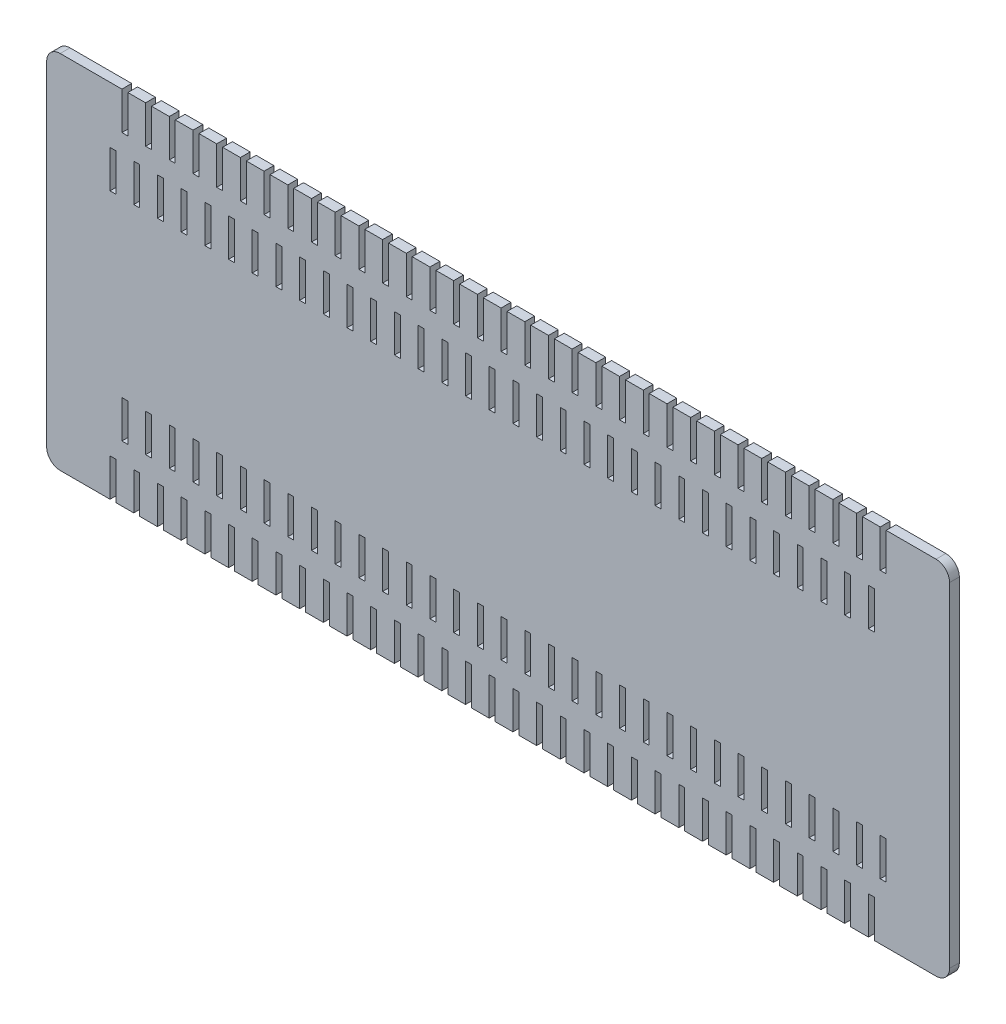
from build123d import *

# Parameters (mm, degrees)
BOSS_EXTRUDE1_DEPTH          = 1.651
SKETCH4_W                    = 1
SKETCH4_H                    = 6.35
CUT_EXTRUDE1_DEPTH           = 83.08651656
LPATTERN1_COUNT              = 33
LPATTERN1_PITCH              = 4
CIRPATTERN1_COUNT            = 2
CIRPATTERN1_ANGLE            = 180
CIRPATTERN1_COPY_1_SKETCH_W  = 1
CIRPATTERN1_COPY_1_SKETCH_H  = 6.35
CIRPATTERN1_COPY_1_DEPTH     = 83.08651656
CIRPATTERN1_COPY_2_SKETCH_W  = 1
CIRPATTERN1_COPY_2_SKETCH_H  = 6.35
CIRPATTERN1_COPY_2_DEPTH     = 83.08651656
CIRPATTERN1_COPY_3_SKETCH_W  = 1
CIRPATTERN1_COPY_3_SKETCH_H  = 6.35
CIRPATTERN1_COPY_3_DEPTH     = 83.08651656
CIRPATTERN1_COPY_4_SKETCH_W  = 1
CIRPATTERN1_COPY_4_SKETCH_H  = 6.35
CIRPATTERN1_COPY_4_DEPTH     = 83.08651656
CIRPATTERN1_COPY_5_SKETCH_W  = 1
CIRPATTERN1_COPY_5_SKETCH_H  = 6.35
CIRPATTERN1_COPY_5_DEPTH     = 83.08651656
CIRPATTERN1_COPY_6_SKETCH_W  = 1
CIRPATTERN1_COPY_6_SKETCH_H  = 6.35
CIRPATTERN1_COPY_6_DEPTH     = 83.08651656
CIRPATTERN1_COPY_7_SKETCH_W  = 1
CIRPATTERN1_COPY_7_SKETCH_H  = 6.35
CIRPATTERN1_COPY_7_DEPTH     = 83.08651656
CIRPATTERN1_COPY_8_SKETCH_W  = 1
CIRPATTERN1_COPY_8_SKETCH_H  = 6.35
CIRPATTERN1_COPY_8_DEPTH     = 83.08651656
CIRPATTERN1_COPY_9_SKETCH_W  = 1
CIRPATTERN1_COPY_9_SKETCH_H  = 6.35
CIRPATTERN1_COPY_9_DEPTH     = 83.08651656
CIRPATTERN1_COPY_10_SKETCH_W = 1
CIRPATTERN1_COPY_10_SKETCH_H = 6.35
CIRPATTERN1_COPY_10_DEPTH    = 83.08651656
CIRPATTERN1_COPY_11_SKETCH_W = 1
CIRPATTERN1_COPY_11_SKETCH_H = 6.35
CIRPATTERN1_COPY_11_DEPTH    = 83.08651656
CIRPATTERN1_COPY_12_SKETCH_W = 1
CIRPATTERN1_COPY_12_SKETCH_H = 6.35
CIRPATTERN1_COPY_12_DEPTH    = 83.08651656
CIRPATTERN1_COPY_13_SKETCH_W = 1
CIRPATTERN1_COPY_13_SKETCH_H = 6.35
CIRPATTERN1_COPY_13_DEPTH    = 83.08651656
CIRPATTERN1_COPY_14_SKETCH_W = 1
CIRPATTERN1_COPY_14_SKETCH_H = 6.35
CIRPATTERN1_COPY_14_DEPTH    = 83.08651656
CIRPATTERN1_COPY_15_SKETCH_W = 1
CIRPATTERN1_COPY_15_SKETCH_H = 6.35
CIRPATTERN1_COPY_15_DEPTH    = 83.08651656
CIRPATTERN1_COPY_16_SKETCH_W = 1
CIRPATTERN1_COPY_16_SKETCH_H = 6.35
CIRPATTERN1_COPY_16_DEPTH    = 83.08651656
CIRPATTERN1_COPY_17_SKETCH_W = 1
CIRPATTERN1_COPY_17_SKETCH_H = 6.35
CIRPATTERN1_COPY_17_DEPTH    = 83.08651656
CIRPATTERN1_COPY_18_SKETCH_W = 1
CIRPATTERN1_COPY_18_SKETCH_H = 6.35
CIRPATTERN1_COPY_18_DEPTH    = 83.08651656
CIRPATTERN1_COPY_19_SKETCH_W = 1
CIRPATTERN1_COPY_19_SKETCH_H = 6.35
CIRPATTERN1_COPY_19_DEPTH    = 83.08651656
CIRPATTERN1_COPY_20_SKETCH_W = 1
CIRPATTERN1_COPY_20_SKETCH_H = 6.35
CIRPATTERN1_COPY_20_DEPTH    = 83.08651656
CIRPATTERN1_COPY_21_SKETCH_W = 1
CIRPATTERN1_COPY_21_SKETCH_H = 6.35
CIRPATTERN1_COPY_21_DEPTH    = 83.08651656
CIRPATTERN1_COPY_22_SKETCH_W = 1
CIRPATTERN1_COPY_22_SKETCH_H = 6.35
CIRPATTERN1_COPY_22_DEPTH    = 83.08651656
CIRPATTERN1_COPY_23_SKETCH_W = 1
CIRPATTERN1_COPY_23_SKETCH_H = 6.35
CIRPATTERN1_COPY_23_DEPTH    = 83.08651656
CIRPATTERN1_COPY_24_SKETCH_W = 1
CIRPATTERN1_COPY_24_SKETCH_H = 6.35
CIRPATTERN1_COPY_24_DEPTH    = 83.08651656
CIRPATTERN1_COPY_25_SKETCH_W = 1
CIRPATTERN1_COPY_25_SKETCH_H = 6.35
CIRPATTERN1_COPY_25_DEPTH    = 83.08651656
CIRPATTERN1_COPY_26_SKETCH_W = 1
CIRPATTERN1_COPY_26_SKETCH_H = 6.35
CIRPATTERN1_COPY_26_DEPTH    = 83.08651656
CIRPATTERN1_COPY_27_SKETCH_W = 1
CIRPATTERN1_COPY_27_SKETCH_H = 6.35
CIRPATTERN1_COPY_27_DEPTH    = 83.08651656
CIRPATTERN1_COPY_28_SKETCH_W = 1
CIRPATTERN1_COPY_28_SKETCH_H = 6.35
CIRPATTERN1_COPY_28_DEPTH    = 83.08651656
CIRPATTERN1_COPY_29_SKETCH_W = 1
CIRPATTERN1_COPY_29_SKETCH_H = 6.35
CIRPATTERN1_COPY_29_DEPTH    = 83.08651656
CIRPATTERN1_COPY_30_SKETCH_W = 1
CIRPATTERN1_COPY_30_SKETCH_H = 6.35
CIRPATTERN1_COPY_30_DEPTH    = 83.08651656
CIRPATTERN1_COPY_31_SKETCH_W = 1
CIRPATTERN1_COPY_31_SKETCH_H = 6.35
CIRPATTERN1_COPY_31_DEPTH    = 83.08651656
CIRPATTERN1_COPY_32_SKETCH_W = 1
CIRPATTERN1_COPY_32_SKETCH_H = 6.35
CIRPATTERN1_COPY_32_DEPTH    = 83.08651656


with BuildPart() as part:
    # Sketch1 → Boss-Extrude1 (new body)
    with BuildSketch(Plane.XY):
        with BuildLine():
            Line((76.2, -28.194), (76.2, 28.194))
            ThreePointArc((76.2, 28.194), (75.530446102, 29.810446102), (73.914, 30.48))
            Line((73.914, 30.48), (-73.914, 30.48))
            ThreePointArc((-73.914, 30.48), (-75.530446102, 29.810446102), (-76.2, 28.194))
            Line((-76.2, 28.194), (-76.2, -28.194))
            ThreePointArc((-76.2, -28.194), (-75.530446102, -29.810446102), (-73.914, -30.48))
            Line((-73.914, -30.48), (73.914, -30.48))
            ThreePointArc((73.914, -30.48), (75.530446102, -29.810446102), (76.2, -28.194))
        make_face()
    extrude(amount=BOSS_EXTRUDE1_DEPTH)

    # Sketch4 → Cut-Extrude1 (cut, through all)
    with BuildSketch(Plane.XY.offset(1.651)):
        with Locations((-63.000000018, 27.305)):
            Rectangle(SKETCH4_W, SKETCH4_H)
        with Locations((-63.000000018, -17.78)):
            Rectangle(SKETCH4_W, SKETCH4_H)
    cut_extrude1 = extrude(amount=-CUT_EXTRUDE1_DEPTH, mode=Mode.SUBTRACT)

    # LPattern1: Cut-Extrude1 ×33
    with Locations(*[(i * LPATTERN1_PITCH, 0, 0) for i in range(1, LPATTERN1_COUNT)]):
        add(cut_extrude1, mode=Mode.SUBTRACT)

    # CirPattern1: Cut-Extrude1 ×2 about axis
    cirpattern1_axis = Axis((0, 0, 0), (0, 0, 1))
    for i in range(1, CIRPATTERN1_COUNT):
        add(cut_extrude1.rotate(cirpattern1_axis, i * CIRPATTERN1_ANGLE / (CIRPATTERN1_COUNT - 1)), mode=Mode.SUBTRACT)

    # CirPattern1 copy 1 sketch → CirPattern1 copy 1 (cut, through all)
    with BuildSketch(Plane(origin=(-4, 0, 1.651), x_dir=(-1, 0, 0), z_dir=(0, 0, 1))):
        with Locations((-63.000000018, 27.305)):
            Rectangle(CIRPATTERN1_COPY_1_SKETCH_W, CIRPATTERN1_COPY_1_SKETCH_H)
        with Locations((-63.000000018, -17.78)):
            Rectangle(CIRPATTERN1_COPY_1_SKETCH_W, CIRPATTERN1_COPY_1_SKETCH_H)
    extrude(amount=-CIRPATTERN1_COPY_1_DEPTH, mode=Mode.SUBTRACT)

    # CirPattern1 copy 2 sketch → CirPattern1 copy 2 (cut, through all)
    with BuildSketch(Plane(origin=(-8, 0, 1.651), x_dir=(-1, 0, 0), z_dir=(0, 0, 1))):
        with Locations((-63.000000018, 27.305)):
            Rectangle(CIRPATTERN1_COPY_2_SKETCH_W, CIRPATTERN1_COPY_2_SKETCH_H)
        with Locations((-63.000000018, -17.78)):
            Rectangle(CIRPATTERN1_COPY_2_SKETCH_W, CIRPATTERN1_COPY_2_SKETCH_H)
    extrude(amount=-CIRPATTERN1_COPY_2_DEPTH, mode=Mode.SUBTRACT)

    # CirPattern1 copy 3 sketch → CirPattern1 copy 3 (cut, through all)
    with BuildSketch(Plane(origin=(-12, 0, 1.651), x_dir=(-1, 0, 0), z_dir=(0, 0, 1))):
        with Locations((-63.000000018, 27.305)):
            Rectangle(CIRPATTERN1_COPY_3_SKETCH_W, CIRPATTERN1_COPY_3_SKETCH_H)
        with Locations((-63.000000018, -17.78)):
            Rectangle(CIRPATTERN1_COPY_3_SKETCH_W, CIRPATTERN1_COPY_3_SKETCH_H)
    extrude(amount=-CIRPATTERN1_COPY_3_DEPTH, mode=Mode.SUBTRACT)

    # CirPattern1 copy 4 sketch → CirPattern1 copy 4 (cut, through all)
    with BuildSketch(Plane(origin=(-16, 0, 1.651), x_dir=(-1, 0, 0), z_dir=(0, 0, 1))):
        with Locations((-63.000000018, 27.305)):
            Rectangle(CIRPATTERN1_COPY_4_SKETCH_W, CIRPATTERN1_COPY_4_SKETCH_H)
        with Locations((-63.000000018, -17.78)):
            Rectangle(CIRPATTERN1_COPY_4_SKETCH_W, CIRPATTERN1_COPY_4_SKETCH_H)
    extrude(amount=-CIRPATTERN1_COPY_4_DEPTH, mode=Mode.SUBTRACT)

    # CirPattern1 copy 5 sketch → CirPattern1 copy 5 (cut, through all)
    with BuildSketch(Plane(origin=(-20, 0, 1.651), x_dir=(-1, 0, 0), z_dir=(0, 0, 1))):
        with Locations((-63.000000018, 27.305)):
            Rectangle(CIRPATTERN1_COPY_5_SKETCH_W, CIRPATTERN1_COPY_5_SKETCH_H)
        with Locations((-63.000000018, -17.78)):
            Rectangle(CIRPATTERN1_COPY_5_SKETCH_W, CIRPATTERN1_COPY_5_SKETCH_H)
    extrude(amount=-CIRPATTERN1_COPY_5_DEPTH, mode=Mode.SUBTRACT)

    # CirPattern1 copy 6 sketch → CirPattern1 copy 6 (cut, through all)
    with BuildSketch(Plane(origin=(-24, 0, 1.651), x_dir=(-1, 0, 0), z_dir=(0, 0, 1))):
        with Locations((-63.000000018, 27.305)):
            Rectangle(CIRPATTERN1_COPY_6_SKETCH_W, CIRPATTERN1_COPY_6_SKETCH_H)
        with Locations((-63.000000018, -17.78)):
            Rectangle(CIRPATTERN1_COPY_6_SKETCH_W, CIRPATTERN1_COPY_6_SKETCH_H)
    extrude(amount=-CIRPATTERN1_COPY_6_DEPTH, mode=Mode.SUBTRACT)

    # CirPattern1 copy 7 sketch → CirPattern1 copy 7 (cut, through all)
    with BuildSketch(Plane(origin=(-28, 0, 1.651), x_dir=(-1, 0, 0), z_dir=(0, 0, 1))):
        with Locations((-63.000000018, 27.305)):
            Rectangle(CIRPATTERN1_COPY_7_SKETCH_W, CIRPATTERN1_COPY_7_SKETCH_H)
        with Locations((-63.000000018, -17.78)):
            Rectangle(CIRPATTERN1_COPY_7_SKETCH_W, CIRPATTERN1_COPY_7_SKETCH_H)
    extrude(amount=-CIRPATTERN1_COPY_7_DEPTH, mode=Mode.SUBTRACT)

    # CirPattern1 copy 8 sketch → CirPattern1 copy 8 (cut, through all)
    with BuildSketch(Plane(origin=(-32, 0, 1.651), x_dir=(-1, 0, 0), z_dir=(0, 0, 1))):
        with Locations((-63.000000018, 27.305)):
            Rectangle(CIRPATTERN1_COPY_8_SKETCH_W, CIRPATTERN1_COPY_8_SKETCH_H)
        with Locations((-63.000000018, -17.78)):
            Rectangle(CIRPATTERN1_COPY_8_SKETCH_W, CIRPATTERN1_COPY_8_SKETCH_H)
    extrude(amount=-CIRPATTERN1_COPY_8_DEPTH, mode=Mode.SUBTRACT)

    # CirPattern1 copy 9 sketch → CirPattern1 copy 9 (cut, through all)
    with BuildSketch(Plane(origin=(-36, 0, 1.651), x_dir=(-1, 0, 0), z_dir=(0, 0, 1))):
        with Locations((-63.000000018, 27.305)):
            Rectangle(CIRPATTERN1_COPY_9_SKETCH_W, CIRPATTERN1_COPY_9_SKETCH_H)
        with Locations((-63.000000018, -17.78)):
            Rectangle(CIRPATTERN1_COPY_9_SKETCH_W, CIRPATTERN1_COPY_9_SKETCH_H)
    extrude(amount=-CIRPATTERN1_COPY_9_DEPTH, mode=Mode.SUBTRACT)

    # CirPattern1 copy 10 sketch → CirPattern1 copy 10 (cut, through all)
    with BuildSketch(Plane(origin=(-40, 0, 1.651), x_dir=(-1, 0, 0), z_dir=(0, 0, 1))):
        with Locations((-63.000000018, 27.305)):
            Rectangle(CIRPATTERN1_COPY_10_SKETCH_W, CIRPATTERN1_COPY_10_SKETCH_H)
        with Locations((-63.000000018, -17.78)):
            Rectangle(CIRPATTERN1_COPY_10_SKETCH_W, CIRPATTERN1_COPY_10_SKETCH_H)
    extrude(amount=-CIRPATTERN1_COPY_10_DEPTH, mode=Mode.SUBTRACT)

    # CirPattern1 copy 11 sketch → CirPattern1 copy 11 (cut, through all)
    with BuildSketch(Plane(origin=(-44, 0, 1.651), x_dir=(-1, 0, 0), z_dir=(0, 0, 1))):
        with Locations((-63.000000018, 27.305)):
            Rectangle(CIRPATTERN1_COPY_11_SKETCH_W, CIRPATTERN1_COPY_11_SKETCH_H)
        with Locations((-63.000000018, -17.78)):
            Rectangle(CIRPATTERN1_COPY_11_SKETCH_W, CIRPATTERN1_COPY_11_SKETCH_H)
    extrude(amount=-CIRPATTERN1_COPY_11_DEPTH, mode=Mode.SUBTRACT)

    # CirPattern1 copy 12 sketch → CirPattern1 copy 12 (cut, through all)
    with BuildSketch(Plane(origin=(-48, 0, 1.651), x_dir=(-1, 0, 0), z_dir=(0, 0, 1))):
        with Locations((-63.000000018, 27.305)):
            Rectangle(CIRPATTERN1_COPY_12_SKETCH_W, CIRPATTERN1_COPY_12_SKETCH_H)
        with Locations((-63.000000018, -17.78)):
            Rectangle(CIRPATTERN1_COPY_12_SKETCH_W, CIRPATTERN1_COPY_12_SKETCH_H)
    extrude(amount=-CIRPATTERN1_COPY_12_DEPTH, mode=Mode.SUBTRACT)

    # CirPattern1 copy 13 sketch → CirPattern1 copy 13 (cut, through all)
    with BuildSketch(Plane(origin=(-52, 0, 1.651), x_dir=(-1, 0, 0), z_dir=(0, 0, 1))):
        with Locations((-63.000000018, 27.305)):
            Rectangle(CIRPATTERN1_COPY_13_SKETCH_W, CIRPATTERN1_COPY_13_SKETCH_H)
        with Locations((-63.000000018, -17.78)):
            Rectangle(CIRPATTERN1_COPY_13_SKETCH_W, CIRPATTERN1_COPY_13_SKETCH_H)
    extrude(amount=-CIRPATTERN1_COPY_13_DEPTH, mode=Mode.SUBTRACT)

    # CirPattern1 copy 14 sketch → CirPattern1 copy 14 (cut, through all)
    with BuildSketch(Plane(origin=(-56, 0, 1.651), x_dir=(-1, 0, 0), z_dir=(0, 0, 1))):
        with Locations((-63.000000018, 27.305)):
            Rectangle(CIRPATTERN1_COPY_14_SKETCH_W, CIRPATTERN1_COPY_14_SKETCH_H)
        with Locations((-63.000000018, -17.78)):
            Rectangle(CIRPATTERN1_COPY_14_SKETCH_W, CIRPATTERN1_COPY_14_SKETCH_H)
    extrude(amount=-CIRPATTERN1_COPY_14_DEPTH, mode=Mode.SUBTRACT)

    # CirPattern1 copy 15 sketch → CirPattern1 copy 15 (cut, through all)
    with BuildSketch(Plane(origin=(-60, 0, 1.651), x_dir=(-1, 0, 0), z_dir=(0, 0, 1))):
        with Locations((-63.000000018, 27.305)):
            Rectangle(CIRPATTERN1_COPY_15_SKETCH_W, CIRPATTERN1_COPY_15_SKETCH_H)
        with Locations((-63.000000018, -17.78)):
            Rectangle(CIRPATTERN1_COPY_15_SKETCH_W, CIRPATTERN1_COPY_15_SKETCH_H)
    extrude(amount=-CIRPATTERN1_COPY_15_DEPTH, mode=Mode.SUBTRACT)

    # CirPattern1 copy 16 sketch → CirPattern1 copy 16 (cut, through all)
    with BuildSketch(Plane(origin=(-64, 0, 1.651), x_dir=(-1, 0, 0), z_dir=(0, 0, 1))):
        with Locations((-63.000000018, 27.305)):
            Rectangle(CIRPATTERN1_COPY_16_SKETCH_W, CIRPATTERN1_COPY_16_SKETCH_H)
        with Locations((-63.000000018, -17.78)):
            Rectangle(CIRPATTERN1_COPY_16_SKETCH_W, CIRPATTERN1_COPY_16_SKETCH_H)
    extrude(amount=-CIRPATTERN1_COPY_16_DEPTH, mode=Mode.SUBTRACT)

    # CirPattern1 copy 17 sketch → CirPattern1 copy 17 (cut, through all)
    with BuildSketch(Plane(origin=(-68, 0, 1.651), x_dir=(-1, 0, 0), z_dir=(0, 0, 1))):
        with Locations((-63.000000018, 27.305)):
            Rectangle(CIRPATTERN1_COPY_17_SKETCH_W, CIRPATTERN1_COPY_17_SKETCH_H)
        with Locations((-63.000000018, -17.78)):
            Rectangle(CIRPATTERN1_COPY_17_SKETCH_W, CIRPATTERN1_COPY_17_SKETCH_H)
    extrude(amount=-CIRPATTERN1_COPY_17_DEPTH, mode=Mode.SUBTRACT)

    # CirPattern1 copy 18 sketch → CirPattern1 copy 18 (cut, through all)
    with BuildSketch(Plane(origin=(-72, 0, 1.651), x_dir=(-1, 0, 0), z_dir=(0, 0, 1))):
        with Locations((-63.000000018, 27.305)):
            Rectangle(CIRPATTERN1_COPY_18_SKETCH_W, CIRPATTERN1_COPY_18_SKETCH_H)
        with Locations((-63.000000018, -17.78)):
            Rectangle(CIRPATTERN1_COPY_18_SKETCH_W, CIRPATTERN1_COPY_18_SKETCH_H)
    extrude(amount=-CIRPATTERN1_COPY_18_DEPTH, mode=Mode.SUBTRACT)

    # CirPattern1 copy 19 sketch → CirPattern1 copy 19 (cut, through all)
    with BuildSketch(Plane(origin=(-76, 0, 1.651), x_dir=(-1, 0, 0), z_dir=(0, 0, 1))):
        with Locations((-63.000000018, 27.305)):
            Rectangle(CIRPATTERN1_COPY_19_SKETCH_W, CIRPATTERN1_COPY_19_SKETCH_H)
        with Locations((-63.000000018, -17.78)):
            Rectangle(CIRPATTERN1_COPY_19_SKETCH_W, CIRPATTERN1_COPY_19_SKETCH_H)
    extrude(amount=-CIRPATTERN1_COPY_19_DEPTH, mode=Mode.SUBTRACT)

    # CirPattern1 copy 20 sketch → CirPattern1 copy 20 (cut, through all)
    with BuildSketch(Plane(origin=(-80, 0, 1.651), x_dir=(-1, 0, 0), z_dir=(0, 0, 1))):
        with Locations((-63.000000018, 27.305)):
            Rectangle(CIRPATTERN1_COPY_20_SKETCH_W, CIRPATTERN1_COPY_20_SKETCH_H)
        with Locations((-63.000000018, -17.78)):
            Rectangle(CIRPATTERN1_COPY_20_SKETCH_W, CIRPATTERN1_COPY_20_SKETCH_H)
    extrude(amount=-CIRPATTERN1_COPY_20_DEPTH, mode=Mode.SUBTRACT)

    # CirPattern1 copy 21 sketch → CirPattern1 copy 21 (cut, through all)
    with BuildSketch(Plane(origin=(-84, 0, 1.651), x_dir=(-1, 0, 0), z_dir=(0, 0, 1))):
        with Locations((-63.000000018, 27.305)):
            Rectangle(CIRPATTERN1_COPY_21_SKETCH_W, CIRPATTERN1_COPY_21_SKETCH_H)
        with Locations((-63.000000018, -17.78)):
            Rectangle(CIRPATTERN1_COPY_21_SKETCH_W, CIRPATTERN1_COPY_21_SKETCH_H)
    extrude(amount=-CIRPATTERN1_COPY_21_DEPTH, mode=Mode.SUBTRACT)

    # CirPattern1 copy 22 sketch → CirPattern1 copy 22 (cut, through all)
    with BuildSketch(Plane(origin=(-88, 0, 1.651), x_dir=(-1, 0, 0), z_dir=(0, 0, 1))):
        with Locations((-63.000000018, 27.305)):
            Rectangle(CIRPATTERN1_COPY_22_SKETCH_W, CIRPATTERN1_COPY_22_SKETCH_H)
        with Locations((-63.000000018, -17.78)):
            Rectangle(CIRPATTERN1_COPY_22_SKETCH_W, CIRPATTERN1_COPY_22_SKETCH_H)
    extrude(amount=-CIRPATTERN1_COPY_22_DEPTH, mode=Mode.SUBTRACT)

    # CirPattern1 copy 23 sketch → CirPattern1 copy 23 (cut, through all)
    with BuildSketch(Plane(origin=(-92, 0, 1.651), x_dir=(-1, 0, 0), z_dir=(0, 0, 1))):
        with Locations((-63.000000018, 27.305)):
            Rectangle(CIRPATTERN1_COPY_23_SKETCH_W, CIRPATTERN1_COPY_23_SKETCH_H)
        with Locations((-63.000000018, -17.78)):
            Rectangle(CIRPATTERN1_COPY_23_SKETCH_W, CIRPATTERN1_COPY_23_SKETCH_H)
    extrude(amount=-CIRPATTERN1_COPY_23_DEPTH, mode=Mode.SUBTRACT)

    # CirPattern1 copy 24 sketch → CirPattern1 copy 24 (cut, through all)
    with BuildSketch(Plane(origin=(-96, 0, 1.651), x_dir=(-1, 0, 0), z_dir=(0, 0, 1))):
        with Locations((-63.000000018, 27.305)):
            Rectangle(CIRPATTERN1_COPY_24_SKETCH_W, CIRPATTERN1_COPY_24_SKETCH_H)
        with Locations((-63.000000018, -17.78)):
            Rectangle(CIRPATTERN1_COPY_24_SKETCH_W, CIRPATTERN1_COPY_24_SKETCH_H)
    extrude(amount=-CIRPATTERN1_COPY_24_DEPTH, mode=Mode.SUBTRACT)

    # CirPattern1 copy 25 sketch → CirPattern1 copy 25 (cut, through all)
    with BuildSketch(Plane(origin=(-100, 0, 1.651), x_dir=(-1, 0, 0), z_dir=(0, 0, 1))):
        with Locations((-63.000000018, 27.305)):
            Rectangle(CIRPATTERN1_COPY_25_SKETCH_W, CIRPATTERN1_COPY_25_SKETCH_H)
        with Locations((-63.000000018, -17.78)):
            Rectangle(CIRPATTERN1_COPY_25_SKETCH_W, CIRPATTERN1_COPY_25_SKETCH_H)
    extrude(amount=-CIRPATTERN1_COPY_25_DEPTH, mode=Mode.SUBTRACT)

    # CirPattern1 copy 26 sketch → CirPattern1 copy 26 (cut, through all)
    with BuildSketch(Plane(origin=(-104, 0, 1.651), x_dir=(-1, 0, 0), z_dir=(0, 0, 1))):
        with Locations((-63.000000018, 27.305)):
            Rectangle(CIRPATTERN1_COPY_26_SKETCH_W, CIRPATTERN1_COPY_26_SKETCH_H)
        with Locations((-63.000000018, -17.78)):
            Rectangle(CIRPATTERN1_COPY_26_SKETCH_W, CIRPATTERN1_COPY_26_SKETCH_H)
    extrude(amount=-CIRPATTERN1_COPY_26_DEPTH, mode=Mode.SUBTRACT)

    # CirPattern1 copy 27 sketch → CirPattern1 copy 27 (cut, through all)
    with BuildSketch(Plane(origin=(-108, 0, 1.651), x_dir=(-1, 0, 0), z_dir=(0, 0, 1))):
        with Locations((-63.000000018, 27.305)):
            Rectangle(CIRPATTERN1_COPY_27_SKETCH_W, CIRPATTERN1_COPY_27_SKETCH_H)
        with Locations((-63.000000018, -17.78)):
            Rectangle(CIRPATTERN1_COPY_27_SKETCH_W, CIRPATTERN1_COPY_27_SKETCH_H)
    extrude(amount=-CIRPATTERN1_COPY_27_DEPTH, mode=Mode.SUBTRACT)

    # CirPattern1 copy 28 sketch → CirPattern1 copy 28 (cut, through all)
    with BuildSketch(Plane(origin=(-112, 0, 1.651), x_dir=(-1, 0, 0), z_dir=(0, 0, 1))):
        with Locations((-63.000000018, 27.305)):
            Rectangle(CIRPATTERN1_COPY_28_SKETCH_W, CIRPATTERN1_COPY_28_SKETCH_H)
        with Locations((-63.000000018, -17.78)):
            Rectangle(CIRPATTERN1_COPY_28_SKETCH_W, CIRPATTERN1_COPY_28_SKETCH_H)
    extrude(amount=-CIRPATTERN1_COPY_28_DEPTH, mode=Mode.SUBTRACT)

    # CirPattern1 copy 29 sketch → CirPattern1 copy 29 (cut, through all)
    with BuildSketch(Plane(origin=(-116, 0, 1.651), x_dir=(-1, 0, 0), z_dir=(0, 0, 1))):
        with Locations((-63.000000018, 27.305)):
            Rectangle(CIRPATTERN1_COPY_29_SKETCH_W, CIRPATTERN1_COPY_29_SKETCH_H)
        with Locations((-63.000000018, -17.78)):
            Rectangle(CIRPATTERN1_COPY_29_SKETCH_W, CIRPATTERN1_COPY_29_SKETCH_H)
    extrude(amount=-CIRPATTERN1_COPY_29_DEPTH, mode=Mode.SUBTRACT)

    # CirPattern1 copy 30 sketch → CirPattern1 copy 30 (cut, through all)
    with BuildSketch(Plane(origin=(-120, 0, 1.651), x_dir=(-1, 0, 0), z_dir=(0, 0, 1))):
        with Locations((-63.000000018, 27.305)):
            Rectangle(CIRPATTERN1_COPY_30_SKETCH_W, CIRPATTERN1_COPY_30_SKETCH_H)
        with Locations((-63.000000018, -17.78)):
            Rectangle(CIRPATTERN1_COPY_30_SKETCH_W, CIRPATTERN1_COPY_30_SKETCH_H)
    extrude(amount=-CIRPATTERN1_COPY_30_DEPTH, mode=Mode.SUBTRACT)

    # CirPattern1 copy 31 sketch → CirPattern1 copy 31 (cut, through all)
    with BuildSketch(Plane(origin=(-124, 0, 1.651), x_dir=(-1, 0, 0), z_dir=(0, 0, 1))):
        with Locations((-63.000000018, 27.305)):
            Rectangle(CIRPATTERN1_COPY_31_SKETCH_W, CIRPATTERN1_COPY_31_SKETCH_H)
        with Locations((-63.000000018, -17.78)):
            Rectangle(CIRPATTERN1_COPY_31_SKETCH_W, CIRPATTERN1_COPY_31_SKETCH_H)
    extrude(amount=-CIRPATTERN1_COPY_31_DEPTH, mode=Mode.SUBTRACT)

    # CirPattern1 copy 32 sketch → CirPattern1 copy 32 (cut, through all)
    with BuildSketch(Plane(origin=(-128, 0, 1.651), x_dir=(-1, 0, 0), z_dir=(0, 0, 1))):
        with Locations((-63.000000018, 27.305)):
            Rectangle(CIRPATTERN1_COPY_32_SKETCH_W, CIRPATTERN1_COPY_32_SKETCH_H)
        with Locations((-63.000000018, -17.78)):
            Rectangle(CIRPATTERN1_COPY_32_SKETCH_W, CIRPATTERN1_COPY_32_SKETCH_H)
    extrude(amount=-CIRPATTERN1_COPY_32_DEPTH, mode=Mode.SUBTRACT)


solid = part.part
